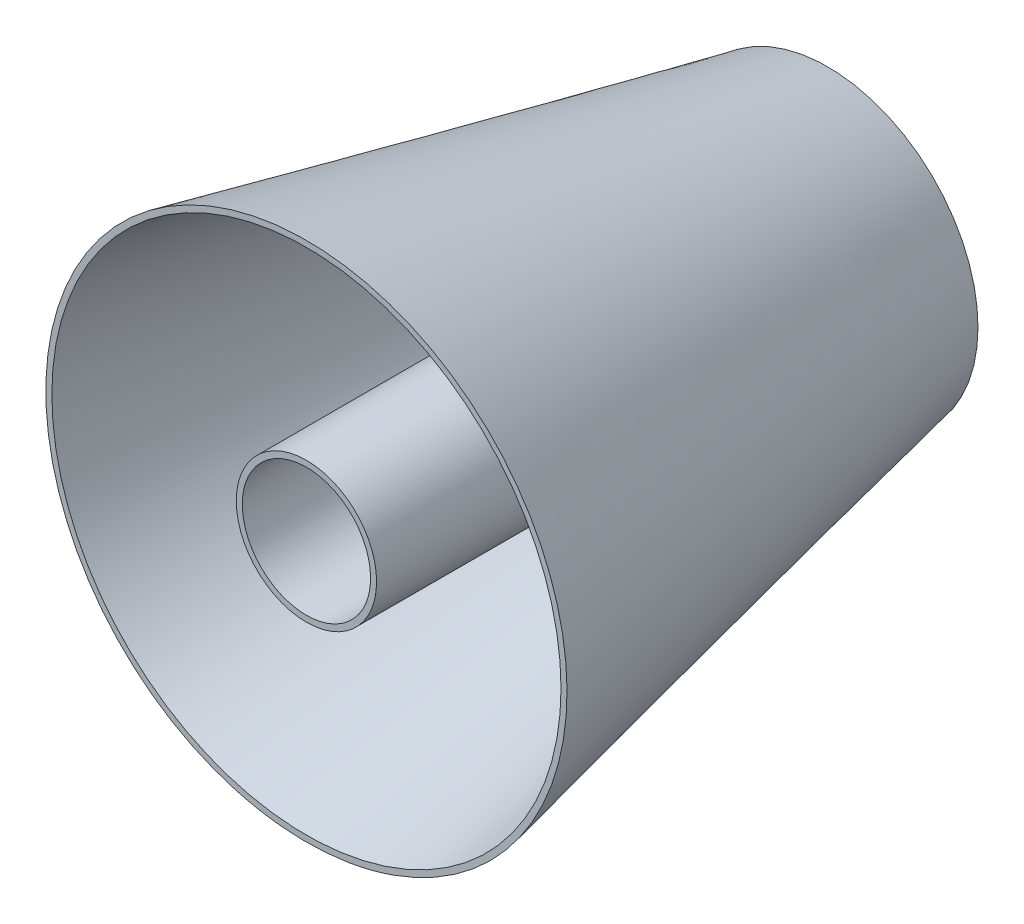
from build123d import *

# Parameters (mm, degrees)
SKETCH3_R           = 72
SKETCH4_R           = 127
SKETCH5_R           = 73.481439627
BOSS_EXTRUDE1_DEPTH = 3
SKETCH6_R           = 35
SKETCH6_R_2         = 32
BOSS_EXTRUDE2_DEPTH = 257


with BuildPart() as part:
    # Loft1: read off the stored shape, not the designer's step
    # Loft1: loft between two sections, ruled curve by curve
    loft1_from = [
        Edge.make_bspline([(-3.838468258, 129.943319033, 260), (256.048169808, 137.62025555, 260), (263.725106325, -122.266382516, 260), (3.838468258, -129.943319033, 260), (-256.048169808, -137.62025555, 260), (-263.725106325, 122.266382516, 260), (-3.838468258, 129.943319033, 260)], [0, 0, 0, 0, 0.5, 0.5, 0.5, 1, 1, 1, 1], 3, [1, 0.333333333, 0.333333333, 1, 0.333333333, 0.333333333, 1]),
    ]
    loft1_to = [
        Edge.make_bspline([(13.35864677, 73.800721924, 0), (160.960090617, 47.083428384, 0), (134.242797078, -100.518015463, 0), (-13.35864677, -73.800721924, 0), (-160.960090617, -47.083428384, 0), (-134.242797078, 100.518015463, 0), (13.35864677, 73.800721924, 0)], [0, 0, 0, 0, 0.5, 0.5, 0.5, 1, 1, 1, 1], 3, [1, 0.333333333, 0.333333333, 1, 0.333333333, 0.333333333, 1]),
    ]
    loft1 = Solid(Shell([*[Face.make_surface_from_curves(loft1_from[k], loft1_to[k]) for k in range(1)], Face(Wire(loft1_from)), Face(Wire(loft1_to))]))
    add(loft1)

    # Sketch3 → Cut-Loft1 section 0
    with BuildSketch(Plane(origin=(0, 0, 0), x_dir=(-1, 0, 0), z_dir=(0, 0, -1))):
        Circle(SKETCH3_R)
    # Sketch4 → Cut-Loft1 section 1
    with BuildSketch(Plane.XY.offset(260)):
        Circle(SKETCH4_R)
    loft(mode=Mode.SUBTRACT)

    # Sketch5 → Boss-Extrude1 (add)
    with BuildSketch(Plane(origin=(0, 0, 0), x_dir=(-1, 0, 0), z_dir=(0, 0, -1))):
        Circle(SKETCH5_R)
    extrude(amount=-BOSS_EXTRUDE1_DEPTH)

    # Sketch6 → Boss-Extrude2 (add)
    with BuildSketch(Plane.XY.offset(3)):
        with Locations(Location((0, 0, 0), (0, 0, 180))):
            Circle(SKETCH6_R)
        Circle(SKETCH6_R_2, mode=Mode.SUBTRACT)
    extrude(amount=BOSS_EXTRUDE2_DEPTH)


solid = part.part
